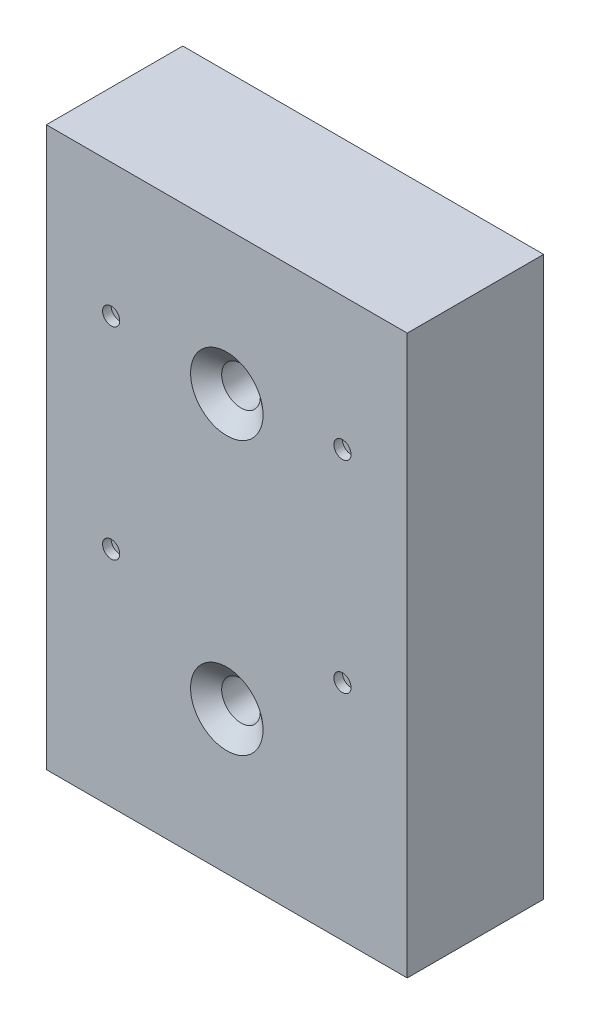
from build123d import *

# Parameters (mm, degrees)
SKETCH1_W                                         = 42
SKETCH1_H                                         = 65
BOSS_EXTRUDE1_DEPTH                               = 15.875
CUT_EXTRUDE1_DEPTH                                = 42.824222946
CUT_EXTRUDE1_DEPTH_BACK                           = 1
SKETCH2_R                                         = 1
CSK_FOR_8_FLAT_HEAD_MACHINE_SCREW_100_D           = 4.4958
CSK_FOR_8_FLAT_HEAD_MACHINE_SCREW_100_CSINK_D     = 8.4328
CSK_FOR_8_FLAT_HEAD_MACHINE_SCREW_100_CSINK_ANGLE = 100


with BuildPart() as part:
    # Sketch1 → Boss-Extrude1 (new body)
    with BuildSketch(Plane.XY):
        Rectangle(SKETCH1_W, SKETCH1_H)
    extrude(amount=BOSS_EXTRUDE1_DEPTH)

    # Sketch2 → Cut-Extrude1 (cut, two sides: drawn at the far end of the back side and taken through both)
    with BuildSketch(Plane.XY.offset(15.875).offset(-CUT_EXTRUDE1_DEPTH_BACK)):
        with Locations((-13.459539776, -6.5)):
            Circle(SKETCH2_R)
        with Locations((-13.459539776, 17)):
            Circle(SKETCH2_R)
        with Locations((13.459539776, 17)):
            Circle(SKETCH2_R)
        with Locations((13.459539776, -6.5)):
            Circle(SKETCH2_R)
    extrude(amount=CUT_EXTRUDE1_DEPTH + CUT_EXTRUDE1_DEPTH_BACK, mode=Mode.SUBTRACT)

    # CSK for #8 Flat Head Machine Screw (100)1 (through all)
    with Locations(Plane.XY.offset(15.875)):
        with Locations((0, 15.875), (0, -15.875)):
            CounterSinkHole(CSK_FOR_8_FLAT_HEAD_MACHINE_SCREW_100_D / 2, CSK_FOR_8_FLAT_HEAD_MACHINE_SCREW_100_CSINK_D / 2, counter_sink_angle=CSK_FOR_8_FLAT_HEAD_MACHINE_SCREW_100_CSINK_ANGLE)


solid = part.part
